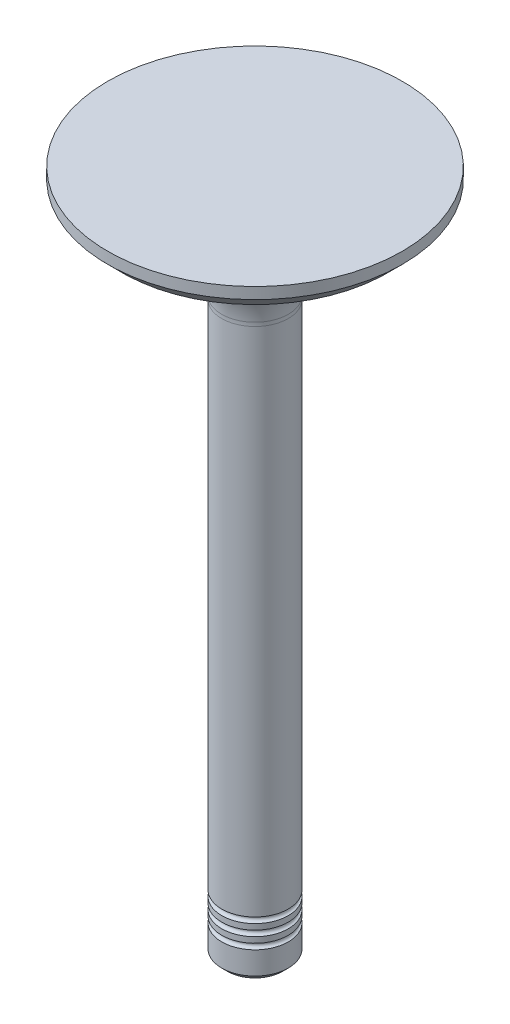
from build123d import *

# Parameters (mm, degrees)
FILLET1_R     = 10
CHAMFER1_SIZE = 1


with BuildPart() as part:
    # Sketch1 → Revolve1 (revolve)
    with BuildSketch(Plane.XY):
        with BuildLine():
            Line((0, 224.082988103), (-25.92, 224.082988103))
            Line((-25.92, 224.082988103), (-25.92, 222.082988103))
            Line((-25.92, 222.082988103), (-23.328, 219.490988103))
            ThreePointArc((-23.328, 219.490988103), (-11.297623362, 215.498292086), (-5.85, 204.052988103))
            Line((-5.85, 204.052988103), (-5.85, 103.822988103))
            Line((-5.85, 103.822988103), (0, 103.822988103))
            Line((0, 103.822988103), (0, 224.082988103))
        make_face()
    revolve(axis=Axis((0, 224.082988103, 0), (0, -1, 0)))

    # Fillet1
    # the kernel refuses this fillet: 10 mm, written as the material it adds along each edge
    with BuildSketch(Plane(origin=(0, 204.052988103, 0), x_dir=(-1, 0, 0), z_dir=(0, 0, 1))) as fillet1_piece_1:
        with BuildLine():
            CenterArc((15.85, 0.254709409), FILLET1_R, 180, 3.822695193)
            Line((5.85, 0.254709409), (5.85, 0))
            ThreePointArc((5.85, 0), (5.85980933, -0.20606196), (5.872248615, -0.411981893))
        make_face()
    revolve(axis=Axis((0, 204.052988103, 0), (0, -1, 0)))

    # Chamfer1
    chamfer1_edges = [part.edges().sort_by_distance(p)[0] for p in [
        (5.85, 103.822988103, 0),
    ]]
    chamfer(chamfer1_edges, length=CHAMFER1_SIZE)

    # Sketch5 → Cut-Revolve2 (revolve, cut)
    with BuildSketch(Plane(origin=(0, 0, 0), x_dir=(0, 0, -1), z_dir=(1, 0, 0))):
        with BuildLine():
            Line((-7.48, 111.822988103), (-5.85, 111.822988103))
            ThreePointArc((-5.85, 111.822988103), (-5.35, 111.322988103), (-5.85, 110.822988103))
            Line((-5.85, 110.822988103), (-7.48, 110.822988103))
            Line((-7.48, 110.822988103), (-7.48, 111.822988103))
        make_face()
        with BuildLine():
            Line((-7.48, 108.822988103), (-5.85, 108.822988103))
            ThreePointArc((-5.85, 108.822988103), (-5.35, 109.322988103), (-5.85, 109.822988103))
            Line((-5.85, 109.822988103), (-7.48, 109.822988103))
            Line((-7.48, 109.822988103), (-7.48, 108.822988103))
        make_face()
        with BuildLine():
            Line((-7.48, 113.822988103), (-5.85, 113.822988103))
            ThreePointArc((-5.85, 113.822988103), (-5.35, 113.322988103), (-5.85, 112.822988103))
            Line((-5.85, 112.822988103), (-7.48, 112.822988103))
            Line((-7.48, 112.822988103), (-7.48, 113.822988103))
        make_face()
    revolve(axis=Axis((0, 203.798278695, 0), (0, -1, 0)), mode=Mode.SUBTRACT)


solid = part.part
